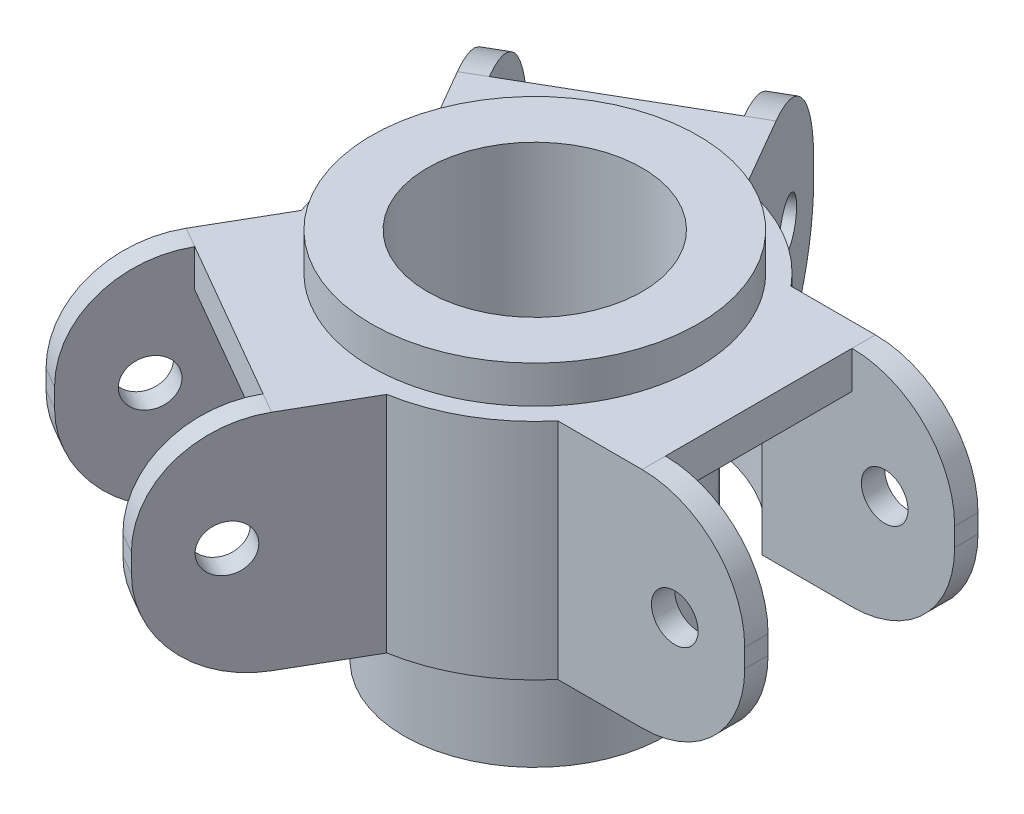
from build123d import *

# Parameters (mm, degrees)
SKETCH1_R               = 14
SKETCH1_R_2             = 11.5
BOSS_EXTRUDE1_DEPTH     = 40
BOSS_EXTRUDE2_START     = -6
SKETCH2_R               = 17.5
SKETCH2_R_2             = 11.5
BOSS_EXTRUDE2_DEPTH     = 6
BOSS_EXTRUDE3_START     = -2
BOSS_EXTRUDE3_OUTLINE_R = 17.5
BOSS_EXTRUDE3_DEPTH     = 24
FILLET1_R               = 11
CUT_EXTRUDE1_DEPTH      = 20
SKETCH5_W               = 11
SKETCH5_H               = 20
CUT_EXTRUDE2_DEPTH      = 20
SKETCH7_R               = 2.5
CUT_EXTRUDE3_DEPTH      = 71.466619449
SKETCH9_R               = 2.5
CUT_EXTRUDE4_DEPTH      = 75.382336321
SKETCH10_R              = 2.5
CUT_EXTRUDE5_DEPTH      = 73.332363728
SKETCH11_R              = 2.5
CUT_EXTRUDE6_DEPTH      = 65.51122859


# Read off the part's stored shape, not the designer's step: Boss-Extrude3
with BuildPart() as part:
    # Sketch1 → Boss-Extrude1 (new body)
    with BuildSketch(Plane(origin=(0, 0, 0), x_dir=(1, 0, 0), z_dir=(0, 1, 0))):
        with Locations(Location((0, 0, 0), (0, 0, 270))):
            Circle(SKETCH1_R)
        with Locations(Location((0, 0, 0), (0, 0, 270))):
            Circle(SKETCH1_R_2, mode=Mode.SUBTRACT)
    extrude(amount=BOSS_EXTRUDE1_DEPTH)

    # Sketch2 → Boss-Extrude2 (add)
    with BuildSketch(Plane(origin=(0, 40, 0), x_dir=(1, 0, 0), z_dir=(0, 1, 0)).offset(BOSS_EXTRUDE2_START)):
        with Locations(Location((0, 0, 0), (0, 0, 270))):
            Circle(SKETCH2_R)
        with Locations(Location((0, 0, 0), (0, 0, 270))):
            Circle(SKETCH2_R_2, mode=Mode.SUBTRACT)
    extrude(amount=BOSS_EXTRUDE2_DEPTH)


with BuildPart() as body_2:
    # Boss-Extrude3 outline → Boss-Extrude3 (new body)
    with BuildSketch(Plane.XZ.offset(-34).offset(BOSS_EXTRUDE3_START)):
        with BuildLine():
            Line((-6.674682453, -36.560889132), (3.342002774, -19.211481397))
            ThreePointArc((3.342002774, -19.211481397), (9.75, -16.887495374), (14.966629547, -12.5))
            Line((14.966629547, -12.5), (35, -12.5))
            Line((35, -12.5), (35, 12.5))
            Line((35, 12.5), (14.966629547, 12.5))
            ThreePointArc((14.966629547, 12.5), (9.75, 16.887495374), (3.342002774, 19.211481397))
            Line((3.342002774, 19.211481397), (-6.674682453, 36.560889132))
            Line((-6.674682453, 36.560889132), (-28.325317547, 24.060889132))
            Line((-28.325317547, 24.060889132), (-18.308632321, 6.711481397))
            ThreePointArc((-18.308632321, 6.711481397), (-19.5, 0), (-18.308632321, -6.711481397))
            Line((-18.308632321, -6.711481397), (-28.325317547, -24.060889132))
            Line((-28.325317547, -24.060889132), (-6.674682453, -36.560889132))
        make_face()
        Circle(BOSS_EXTRUDE3_OUTLINE_R, mode=Mode.SUBTRACT)
    extrude(amount=BOSS_EXTRUDE3_DEPTH)

    # Fillet1
    fillet1_edges = [body_2.edges().sort_by_distance(p)[0] for p in [
        (35, 36, 0),
        (35, 12, 0),
        (-17.5, 12, 30.310889132),
        (-17.5, 36, 30.310889132),
        (-17.5, 12, -30.310889132),
        (-17.5, 36, -30.310889132),
    ]]
    fillet(fillet1_edges, radius=FILLET1_R)

    # Sketch4 → Cut-Extrude1 (cut)
    with BuildSketch(Plane.XZ.offset(-12)):
        with BuildLine():
            Line((36.429567038, 10), (14.361406616, 10))
            ThreePointArc((14.361406616, 10), (17.5, 0), (14.361406616, -10))
            Line((14.361406616, -10), (36.429567038, -10))
            Line((36.429567038, -10), (36.429567038, 10))
        make_face()
        with BuildLine():
            Line((-9.554529481, -36.548930504), (1.47955073, -17.437342964))
            ThreePointArc((1.47955073, -17.437342964), (-8.75, -15.155444566), (-15.840957346, -7.437342964))
            Line((-15.840957346, -7.437342964), (-26.875037557, -26.548930504))
            Line((-26.875037557, -26.548930504), (-9.554529481, -36.548930504))
        make_face()
        with BuildLine():
            Line((-26.875037557, 26.548930504), (-15.840957346, 7.437342964))
            ThreePointArc((-15.840957346, 7.437342964), (-8.75, 15.155444566), (1.47955073, 17.437342964))
            Line((1.47955073, 17.437342964), (-9.554529481, 36.548930504))
            Line((-9.554529481, 36.548930504), (-26.875037557, 26.548930504))
        make_face()
    extrude(amount=-CUT_EXTRUDE1_DEPTH, mode=Mode.SUBTRACT)

    # Sketch5 → Cut-Extrude2 (cut)
    with BuildSketch(Plane.XZ.offset(-32)):
        with Locations((29.5, 0)):
            Rectangle(SKETCH5_W, SKETCH5_H)
        Polygon((-3.339745962, -25.784609691), (-8.839745962, -35.310889132), (-26.160254038, -25.310889132), (-20.660254038, -15.784609691), align=None)
        Polygon((-20.660254038, 15.784609691), (-26.160254038, 25.310889132), (-8.839745962, 35.310889132), (-3.339745962, 25.784609691), align=None)
    extrude(amount=-CUT_EXTRUDE2_DEPTH, mode=Mode.SUBTRACT)

    # Sketch7 → Cut-Extrude3 (cut, through all)
    with BuildSketch(Plane(origin=(10.825317547, 0, 6.25), x_dir=(0.5000000000000043, 0, -0.8660254037844363), z_dir=(0.8660254037844363, 0, 0.5000000000000043))):
        with Locations((-27.5, 24)):
            Circle(SKETCH7_R)
    extrude(amount=-CUT_EXTRUDE3_DEPTH, mode=Mode.SUBTRACT)

    # Sketch9 → Cut-Extrude4 (cut, through all)
    with BuildSketch(Plane(origin=(-10.825317547, 0, 6.25), x_dir=(0.49999999999999195, 0, 0.8660254037844433), z_dir=(-0.8660254037844433, 0, 0.49999999999999195))):
        with Locations((-27.5, 24)):
            Circle(SKETCH9_R)
    extrude(amount=-CUT_EXTRUDE4_DEPTH, mode=Mode.SUBTRACT)

    # Sketch10 → Cut-Extrude5 (cut, through all)
    with BuildSketch(Plane(origin=(0, 0, -12.5), x_dir=(-1, 0, 0), z_dir=(0, 0, -1))):
        with Locations((-27.5, 24)):
            Circle(SKETCH10_R)
    extrude(amount=-CUT_EXTRUDE5_DEPTH, mode=Mode.SUBTRACT)


with BuildPart() as cut_extrude6_tool:
    # Sketch11 → Cut-Extrude6 (new, through all)
    with BuildSketch(Plane(origin=(0, 0, 0), x_dir=(0, 0, -1), z_dir=(1, 0, 0))):
        with Locations((0, 24)):
            Circle(SKETCH11_R)
    extrude(amount=-CUT_EXTRUDE6_DEPTH)


with BuildPart() as part_1:
    add(part.part)

    # Cut-Extrude6: cut by cut_extrude6_tool
    add(cut_extrude6_tool.part, mode=Mode.SUBTRACT)


with BuildPart() as body_2_1:
    add(body_2.part)

    # Cut-Extrude6: cut by cut_extrude6_tool
    add(cut_extrude6_tool.part, mode=Mode.SUBTRACT)


solid = Compound([part_1.part, body_2_1.part])
